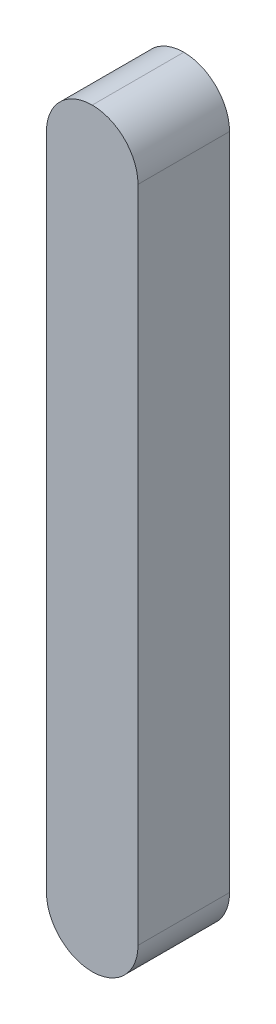
from build123d import *

# Parameters (mm, degrees)
SKETCH1_W           = 5
SKETCH1_H           = 5
BOSS_EXTRUDE1_DEPTH = 20.5
FILLET1_R           = 2.5


with BuildPart() as part:
    # Sketch1 → Boss-Extrude1 (new, symmetric)
    with BuildSketch(Plane(origin=(0, 0, 0), x_dir=(1, 0, 0), z_dir=(0, 1, 0))):
        Rectangle(SKETCH1_W, SKETCH1_H)
    extrude(amount=BOSS_EXTRUDE1_DEPTH, both=True)

    # Fillet1
    fillet1_edges = [part.edges().sort_by_distance(p)[0] for p in [
        (-2.5, -20.5, 0),
        (2.5, -20.5, 0),
        (2.5, 20.5, 0),
        (-2.5, 20.5, 0),
    ]]
    fillet(fillet1_edges, radius=FILLET1_R - 0.0001)  # a hair under: the kernel refuses the full size


solid = part.part
